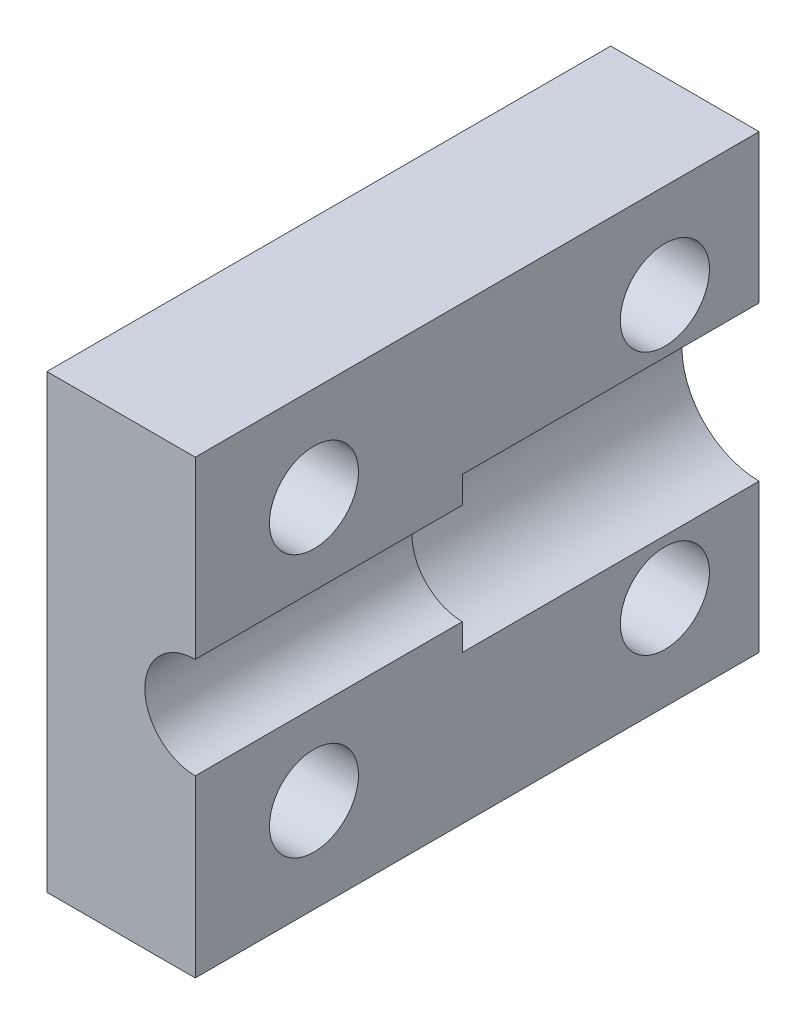
from build123d import *

# Parameters (mm, degrees)
EXTRUDE1_DEPTH = 10
EXTRUDE2_DEPTH = 9
SKETCH4_R      = 1.5
EXTRUDE3_DEPTH = 22.065611788


with BuildPart() as part:
    # Sketch1 → Extrude1 (new body)
    with BuildSketch(Plane.XY):
        with BuildLine():
            Line((0, 2.6), (0, 7.6))
            Line((0, 7.6), (-5, 7.6))
            Line((-5, 7.6), (-5, -7.6))
            Line((-5, -7.6), (0, -7.6))
            Line((0, -7.6), (0, -2.6))
            ThreePointArc((0, -2.6), (-2.6, 0), (0, 2.6))
        make_face()
    extrude(amount=EXTRUDE1_DEPTH)

    # Sketch2 → Extrude2 (add)
    with BuildSketch(Plane.XY.offset(10)):
        with BuildLine():
            Line((0, 1.7), (0, 7.6))
            Line((0, 7.6), (-5, 7.6))
            Line((-5, 7.6), (-5, -7.6))
            Line((-5, -7.6), (0, -7.6))
            Line((0, -7.6), (0, -1.7))
            ThreePointArc((0, -1.7), (-1.7, 0), (0, 1.7))
        make_face()
    extrude(amount=EXTRUDE2_DEPTH)

    # Sketch4 → Extrude3 (cut, through all)
    with BuildSketch(Plane.ZY.offset(5)):
        with Locations((3.175, 4.425)):
            Circle(SKETCH4_R)
        with Locations((15, 4.425)):
            Circle(SKETCH4_R)
        with Locations((15, -4.425)):
            Circle(SKETCH4_R)
        with Locations((3.175, -4.425)):
            Circle(SKETCH4_R)
    extrude(amount=-EXTRUDE3_DEPTH, mode=Mode.SUBTRACT)


solid = part.part
